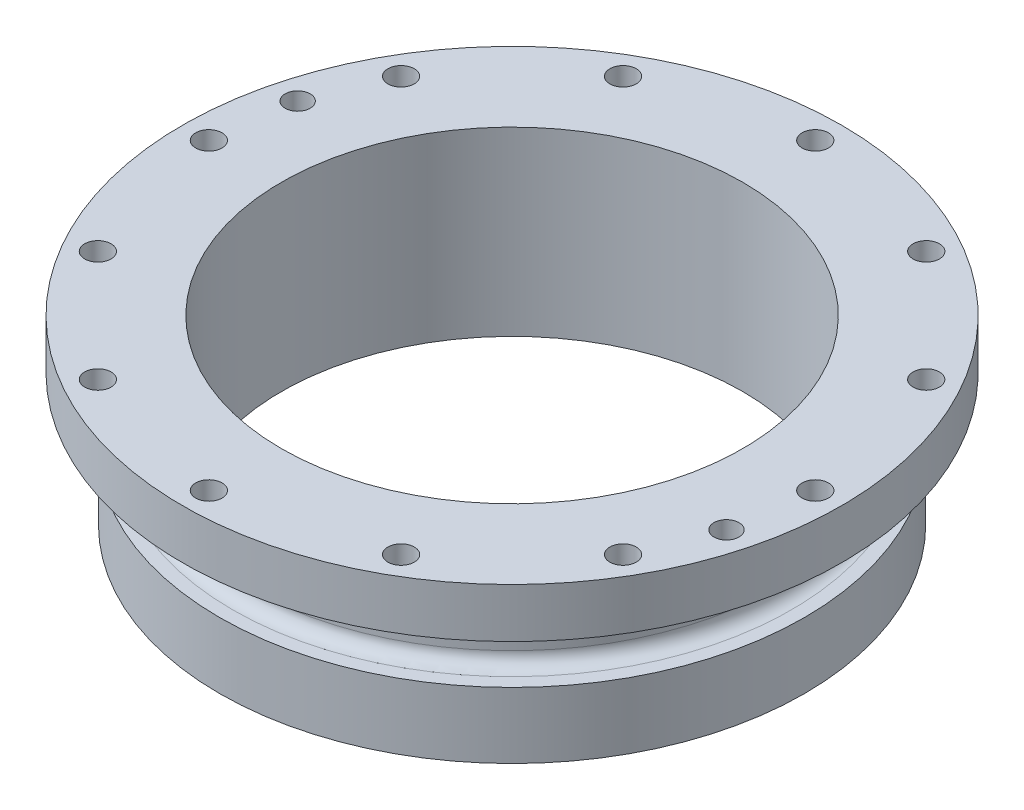
from build123d import *

# Parameters (mm, degrees)
SKETCH2_R           = 56.35625
BOSS_EXTRUDE1_DEPTH = 25.4
SKETCH3_R           = 63.5
BOSS_EXTRUDE2_DEPTH = 9.525
SKETCH4_R           = 44.45
CUT_EXTRUDE1_DEPTH  = 97.35484225
SKETCH9_W           = 5.08
SKETCH9_H           = 12.7
FILLET1_R           = 2.54
SKETCH10_R          = 2.54
CUT_EXTRUDE2_DEPTH  = 94.3255592
CIRPATTERN1_COUNT   = 12
HOLE2_START         = 30.099
HOLE2_OUTLINE_R     = 2.413
HOLE2_DEPTH         = 4.826
HOLE2_START_2       = 25.485046345
HOLE2_2_OUTLINE_R   = 1.143
HOLE2_2_DEPTH       = 4.613953655
CIRPATTERN2_COUNT   = 2
HOLE3_D             = 2.286
HOLE3_DEPTH         = 9.438944644
HOLE3_CBORE_D       = 4.826
HOLE3_CBORE_DEPTH   = 4.826
CIRPATTERN3_COUNT   = 2


# Read off the part's stored shape, not the designer's step: Hole2
with BuildPart() as part:
    # Sketch2 → Boss-Extrude1 (new body)
    with BuildSketch(Plane(origin=(0, 0, 0), x_dir=(1, 0, 0), z_dir=(0, 1, 0))):
        with Locations(Location((0, 0, 0), (0, 0, 270))):
            Circle(SKETCH2_R)
    extrude(amount=BOSS_EXTRUDE1_DEPTH)

    # Sketch3 → Boss-Extrude2 (add)
    with BuildSketch(Plane(origin=(0, 25.4, 0), x_dir=(1, 0, 0), z_dir=(0, 1, 0))):
        with Locations(Location((0, 0, 0), (0, 0, 90))):
            Circle(SKETCH3_R)
    extrude(amount=BOSS_EXTRUDE2_DEPTH)

    # Sketch4 → Cut-Extrude1 (cut, through all)
    with BuildSketch(Plane.XZ):
        with Locations(Location((0, 0, 0), (0, 0, 270))):
            Circle(SKETCH4_R)
    extrude(amount=-CUT_EXTRUDE1_DEPTH, mode=Mode.SUBTRACT)

    # Sketch9 → Cut-Revolve1 (revolve, cut)
    with BuildSketch(Plane(origin=(0, 0, 0), x_dir=(0, 0, -1), z_dir=(1, 0, 0))):
        with Locations((53.81625, 19.05)):
            Rectangle(SKETCH9_W, SKETCH9_H)
    revolve(axis=Axis((0, 0, 0), (0, 1, 0)), mode=Mode.SUBTRACT)

    # Fillet1
    fillet1_edges = [part.edges().sort_by_distance(p)[0] for p in [
        (0, 12.7, 51.27625),
        (0, 25.4, 51.27625),
    ]]
    fillet(fillet1_edges, radius=FILLET1_R)

    # Sketch10 → Cut-Extrude2 (cut, through all)
    with BuildSketch(Plane.XZ.offset(-25.4)):
        with Locations(Location((58.42, 0, 0), (0, 0, 270))):
            Circle(SKETCH10_R)
        with Locations(Location((50.593204089, -29.21, 0), (0, 0, 270))):
            Circle(SKETCH10_R)
        with Locations(Location((29.21, -50.593204089, 0), (0, 0, 270))):
            Circle(SKETCH10_R)
        with Locations(Location((0, -58.42, 0), (0, 0, 270))):
            Circle(SKETCH10_R)
        with Locations(Location((-29.21, -50.593204089, 0), (0, 0, 270))):
            Circle(SKETCH10_R)
        with Locations(Location((-50.593204089, -29.21, 0), (0, 0, 270))):
            Circle(SKETCH10_R)
        with Locations(Location((-58.42, 0, 0), (0, 0, 270))):
            Circle(SKETCH10_R)
        with Locations(Location((-50.593204089, 29.21, 0), (0, 0, 270))):
            Circle(SKETCH10_R)
        with Locations(Location((-29.21, 50.593204089, 0), (0, 0, 270))):
            Circle(SKETCH10_R)
        with Locations(Location((0, 58.42, 0), (0, 0, 270))):
            Circle(SKETCH10_R)
        with Locations(Location((29.21, 50.593204089, 0), (0, 0, 270))):
            Circle(SKETCH10_R)
        with Locations(Location((50.593204089, 29.21, 0), (0, 0, 270))):
            Circle(SKETCH10_R)
    extrude(amount=-CUT_EXTRUDE2_DEPTH, mode=Mode.SUBTRACT)

    # Sketch12 → #10-32 Tapped Hole1 (revolve, cut)
    with BuildSketch(Plane(origin=(51.562, 0, 0), x_dir=(0, 0, -1), z_dir=(1, 0, 0))):
        Polygon((0, 0), (0, 10.103317848), (2.0193, 8.89), (2.0193, 1.0287), (3.048, 0), align=None)
    f_10_32_tapped_hole1 = revolve(axis=Axis((51.562, -6.35, 0), (0, 1, 0)), mode=Mode.SUBTRACT)

    # CirPattern1: #10-32 Tapped Hole1 ×12 about axis
    cirpattern1_axis = Axis((0, 0, 0), (0, 1, 0))
    for i in range(1, CIRPATTERN1_COUNT):
        add(f_10_32_tapped_hole1.rotate(cirpattern1_axis, i * 360 / CIRPATTERN1_COUNT), mode=Mode.SUBTRACT)

    # Hole2 outline → Hole2 (cut)
    with BuildSketch(Plane(origin=(0, 0, 0), x_dir=(1, 0, 0), z_dir=(0, 1, 0)).offset(HOLE2_START)):
        with Locations((56.429386772, -15.120208615)):
            Circle(HOLE2_OUTLINE_R)
    hole2 = extrude(amount=HOLE2_DEPTH, mode=Mode.SUBTRACT)

    # Hole2 2 outline → Hole2 2 (cut)
    with BuildSketch(Plane(origin=(0, 0, 0), x_dir=(1, 0, 0), z_dir=(0, 1, 0)).offset(HOLE2_START_2)):
        with Locations((56.429386772, -15.120208615)):
            Circle(HOLE2_2_OUTLINE_R)
    hole2_2 = extrude(amount=HOLE2_2_DEPTH, mode=Mode.SUBTRACT)

    # CirPattern2: Hole2, Hole2 2 ×2 about axis
    cirpattern2_axis = Axis((0, 0, 0), (0, 1, 0))
    add([hole2.rotate(cirpattern2_axis, i * 360 / CIRPATTERN2_COUNT) for i in range(1, CIRPATTERN2_COUNT)], mode=Mode.SUBTRACT)
    add([hole2_2.rotate(cirpattern2_axis, i * 360 / CIRPATTERN2_COUNT) for i in range(1, CIRPATTERN2_COUNT)], mode=Mode.SUBTRACT)

    # Hole3
    with Locations(Plane(origin=(0, 0, 0), x_dir=(-1, 0, 0), z_dir=(0, -1, 0))):
        with Locations((-13.345227604, -49.805067455)):
            hole3 = CounterBoreHole(HOLE3_D / 2, HOLE3_CBORE_D / 2, HOLE3_CBORE_DEPTH, depth=HOLE3_DEPTH)

    # CirPattern3: Hole3 ×2 about axis
    cirpattern3_axis = Axis((0, 0, 0), (0, 1, 0))
    for i in range(1, CIRPATTERN3_COUNT):
        add(hole3.rotate(cirpattern3_axis, i * 360 / CIRPATTERN3_COUNT), mode=Mode.SUBTRACT)


solid = part.part
